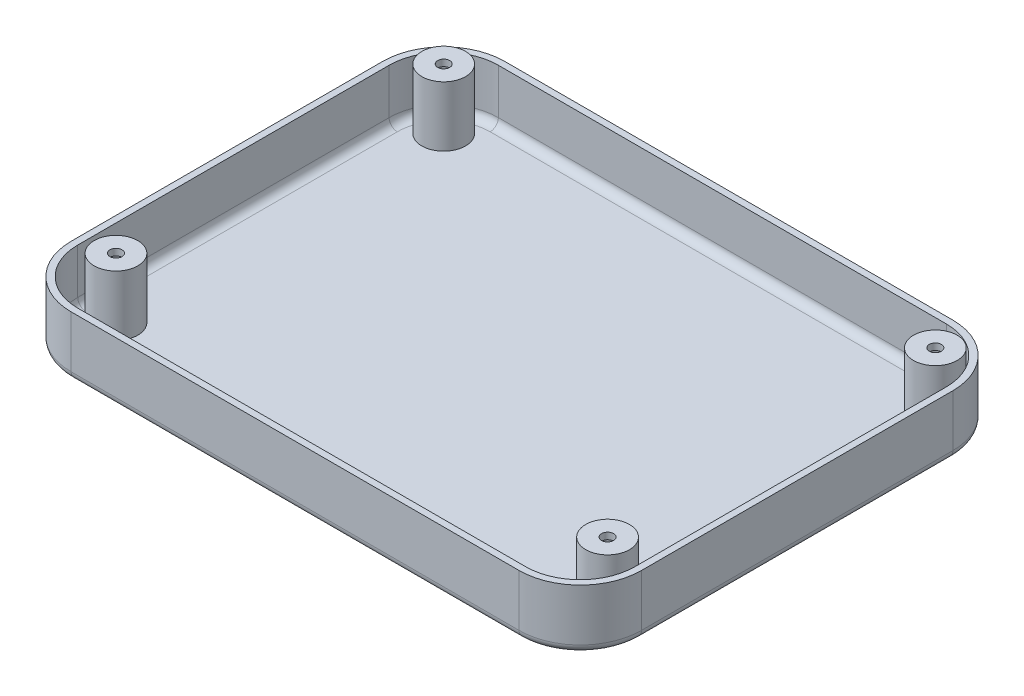
from build123d import *

# Parameters (mm, degrees)
EXTRUDE_3_DEPTH     = 1.2
EXTRUDE_4_DEPTH     = 11
SKETCH_6_R          = 4
SKETCH_6_R_2        = 2.4
EXTRUDE_5_DEPTH     = 11
CUT_EXTRUDE_START   = -10
SKETCH_7_R          = 2.4
SKETCH_7_R_2        = 1.7
CUT_EXTRUDE_1_DEPTH = 10
EXTRUDE_START       = -1.2
SKETCH_8_R          = 2.4
SKETCH_8_R_2        = 1.1
EXTRUDE_6_DEPTH     = 1.2
FILLET_1_R          = 1.5


with BuildPart() as part:
    # 草图1 → 凸台-拉伸3 (new body)
    with BuildSketch(Plane(origin=(0, 0, 0), x_dir=(1, 0, 0), z_dir=(0, 1, 0))):
        with BuildLine():
            Line((51, -26), (51, 26))
            ThreePointArc((51, 26), (48.071067812, 33.071067812), (41, 36))
            Line((41, 36), (-41, 36))
            ThreePointArc((-41, 36), (-48.071067812, 33.071067812), (-51, 26))
            Line((-51, 26), (-51, -26))
            Line((-51, -26), (-51, -31))
            ThreePointArc((-51, -31), (-48.071067812, -38.071067812), (-41, -41))
            Line((-41, -41), (41, -41))
            ThreePointArc((41, -41), (48.071067812, -38.071067812), (51, -31))
            Line((51, -31), (51, -26))
        make_face()
    extrude(amount=EXTRUDE_3_DEPTH)

    # 草图4 → 凸台-拉伸4 (add)
    with BuildSketch(Plane(origin=(0, 0, 0), x_dir=(1, 0, 0), z_dir=(0, 1, 0))):
        with BuildLine():
            Line((-41, 37.2), (41, 37.2))
            ThreePointArc((41, 37.2), (48.919595949, 33.919595949), (52.2, 26))
            Line((52.2, 26), (52.2, -26))
            Line((52.2, -26), (52.2, -31))
            ThreePointArc((52.2, -31), (48.919633331, -38.919505702), (41.000127629, -42.199872371))
            Line((41.000127629, -42.199872371), (-41.000127629, -42.199872371))
            ThreePointArc((-41.000127629, -42.199872371), (-48.919633331, -38.919505702), (-52.2, -31))
            Line((-52.2, -31), (-52.2, -26))
            Line((-52.2, -26), (-52.2, 26))
            ThreePointArc((-52.2, 26), (-48.919595949, 33.919595949), (-41, 37.2))
        make_face()
        with BuildLine():
            Line((51, -26), (51, 26))
            ThreePointArc((51, 26), (48.071067812, 33.071067812), (41, 36))
            Line((41, 36), (-41, 36))
            ThreePointArc((-41, 36), (-48.071067812, 33.071067812), (-51, 26))
            Line((-51, 26), (-51, -26))
            Line((-51, -26), (-51, -31))
            ThreePointArc((-51, -31), (-48.071105194, -38.070977564), (-41.000127629, -40.999872371))
            Line((-41.000127629, -40.999872371), (41.000127629, -40.999872371))
            ThreePointArc((41.000127629, -40.999872371), (48.071105194, -38.070977564), (51, -31))
            Line((51, -31), (51, -26))
        make_face(mode=Mode.SUBTRACT)
    extrude(amount=EXTRUDE_4_DEPTH)

    # 草图6 → 凸台-拉伸5 (add)
    # profile 1 of 4: a face of its own
    with BuildSketch(Plane(origin=(0, 1.2, 0), x_dir=(1, 0, 0), z_dir=(0, 1, 0))):
        with Locations(Location((-45, 30, 0), (0, 0, 90))):
            Circle(SKETCH_6_R)
        with Locations(Location((-45, 30, 0), (0, 0, 270))):
            Circle(SKETCH_6_R_2, mode=Mode.SUBTRACT)
    # profile 2 of 4: a face of its own
    with BuildSketch(Plane(origin=(0, 1.2, 0), x_dir=(1, 0, 0), z_dir=(0, 1, 0))):
        with Locations(Location((45, 30, 0), (0, 0, 90))):
            Circle(SKETCH_6_R)
        with Locations(Location((45, 30, 0), (0, 0, 90))):
            Circle(SKETCH_6_R_2, mode=Mode.SUBTRACT)
    # profile 3 of 4: a face of its own
    with BuildSketch(Plane(origin=(0, 1.2, 0), x_dir=(1, 0, 0), z_dir=(0, 1, 0))):
        with Locations(Location((45, -30, 0), (0, 0, 90))):
            Circle(SKETCH_6_R)
        with Locations(Location((45, -30, 0), (0, 0, 270))):
            Circle(SKETCH_6_R_2, mode=Mode.SUBTRACT)
    # profile 4 of 4: a face of its own
    with BuildSketch(Plane(origin=(0, 1.2, 0), x_dir=(1, 0, 0), z_dir=(0, 1, 0))):
        with Locations(Location((-45, -30, 0), (0, 0, 90))):
            Circle(SKETCH_6_R)
        with Locations(Location((-45, -30, 0), (0, 0, 90))):
            Circle(SKETCH_6_R_2, mode=Mode.SUBTRACT)
    extrude(amount=EXTRUDE_5_DEPTH)

    # 草图7 → 切除-拉伸1 (cut)
    with BuildSketch(Plane(origin=(0, 1.2, 0), x_dir=(1, 0, 0), z_dir=(0, 1, 0)).offset(CUT_EXTRUDE_START)):
        with Locations(Location((-45, 30, 0), (0, 0, 90))):
            Circle(SKETCH_7_R)
        with Locations(Location((45, 30, 0), (0, 0, 270))):
            Circle(SKETCH_7_R_2)
        with Locations(Location((45, -30, 0), (0, 0, 270))):
            Circle(SKETCH_7_R_2)
        with Locations(Location((-45, -30, 0), (0, 0, 90))):
            Circle(SKETCH_7_R)
    extrude(amount=CUT_EXTRUDE_1_DEPTH, mode=Mode.SUBTRACT)

    # 草图8 → 凸台-拉伸6 (add)
    # profile 1 of 4: a face of its own
    with BuildSketch(Plane(origin=(0, 12.2, 0), x_dir=(1, 0, 0), z_dir=(0, 1, 0)).offset(EXTRUDE_START)):
        with Locations(Location((-45, 30, 0), (0, 0, 90))):
            Circle(SKETCH_8_R)
        with Locations(Location((-45, 30, 0), (0, 0, 270))):
            Circle(SKETCH_8_R_2, mode=Mode.SUBTRACT)
    # profile 2 of 4: a face of its own
    with BuildSketch(Plane(origin=(0, 12.2, 0), x_dir=(1, 0, 0), z_dir=(0, 1, 0)).offset(EXTRUDE_START)):
        with Locations(Location((45, 30, 0), (0, 0, 90))):
            Circle(SKETCH_8_R)
        with Locations(Location((45, 30, 0), (0, 0, 90))):
            Circle(SKETCH_8_R_2, mode=Mode.SUBTRACT)
    # profile 3 of 4: a face of its own
    with BuildSketch(Plane(origin=(0, 12.2, 0), x_dir=(1, 0, 0), z_dir=(0, 1, 0)).offset(EXTRUDE_START)):
        with Locations(Location((45, -30, 0), (0, 0, 270))):
            Circle(SKETCH_8_R)
        with Locations(Location((45, -30, 0), (0, 0, 270))):
            Circle(SKETCH_8_R_2, mode=Mode.SUBTRACT)
    # profile 4 of 4: a face of its own
    with BuildSketch(Plane(origin=(0, 12.2, 0), x_dir=(1, 0, 0), z_dir=(0, 1, 0)).offset(EXTRUDE_START)):
        with Locations(Location((-45, -30, 0), (0, 0, 90))):
            Circle(SKETCH_8_R)
        with Locations(Location((-45, -30, 0), (0, 0, 90))):
            Circle(SKETCH_8_R_2, mode=Mode.SUBTRACT)
    extrude(amount=EXTRUDE_6_DEPTH)

    # 圆角1
    # the kernel refuses this fillet: 1.5 mm, written as the material it adds along each edge
    with BuildSketch(Plane(origin=(-41, 1.2, -26), x_dir=(0, 0, -1), z_dir=(1, 0, 0))) as fillet_1_piece_1:
        with BuildLine():
            CenterArc((10 - FILLET_1_R, FILLET_1_R), FILLET_1_R, 270, 90)
            Line((10, FILLET_1_R), (10, 0))
            Line((10, 0), (10 - FILLET_1_R, 0))
        make_face()
    revolve(axis=Axis((-41, 1.2, -26), (0, 1, 0)), revolution_arc=90)
    with BuildSketch(Plane(origin=(-51, 1.2, 31), x_dir=(1, 0, 0), z_dir=(0, 0, -1)), Plane(origin=(51, 1.2, -26), x_dir=(-1, 0, 0), z_dir=(0, 0, 1))) as fillet_1_piece_2:
        with BuildLine():
            CenterArc((FILLET_1_R, -FILLET_1_R), FILLET_1_R, 90, 90)
            Line((0, -FILLET_1_R), (0, 0))
            Line((0, 0), (FILLET_1_R, 0))
        make_face()
    extrude(amount=57)
    with BuildSketch(Plane(origin=(41, 1.2, -26), x_dir=(1, 0, 0), z_dir=(0, 0, 1))) as fillet_1_piece_3:
        with BuildLine():
            CenterArc((10 - FILLET_1_R, FILLET_1_R), FILLET_1_R, 270, 90)
            Line((10, FILLET_1_R), (10, 0))
            Line((10, 0), (10 - FILLET_1_R, 0))
        make_face()
    revolve(axis=Axis((41, 1.2, -26), (0, 1, 0)), revolution_arc=90)
    with BuildSketch(Plane(origin=(-41.000127629, 1.2, 31), x_dir=(0, 0, 1), z_dir=(1, 0, 0))) as fillet_1_piece_4:
        with BuildLine():
            CenterArc((9.999872371 - FILLET_1_R, -FILLET_1_R), FILLET_1_R, 0, 90)
            Line((9.999872371, -FILLET_1_R), (9.999872371, 0))
            Line((9.999872371, 0), (9.999872371 - FILLET_1_R, 0))
        make_face()
    revolve(axis=Axis((-41.000127629, 1.2, 31), (0, -1, 0)), revolution_arc=90)
    with BuildSketch(Plane(origin=(41.000127629, 1.2, 40.999872371), x_dir=(0, 0, -1), z_dir=(-1, 0, 0))) as fillet_1_piece_5:
        with BuildLine():
            CenterArc((FILLET_1_R, -FILLET_1_R), FILLET_1_R, 90, 90)
            Line((0, -FILLET_1_R), (0, 0))
            Line((0, 0), (FILLET_1_R, 0))
        make_face()
    extrude(amount=82.000255259)
    with BuildSketch(Plane(origin=(41.000127629, 1.2, 31), x_dir=(1, 0, 0), z_dir=(0, 0, -1))) as fillet_1_piece_6:
        with BuildLine():
            CenterArc((9.999872371 - FILLET_1_R, -FILLET_1_R), FILLET_1_R, 0, 90)
            Line((9.999872371, -FILLET_1_R), (9.999872371, 0))
            Line((9.999872371, 0), (9.999872371 - FILLET_1_R, 0))
        make_face()
    revolve(axis=Axis((41.000127629, 1.2, 31), (0, -1, 0)), revolution_arc=90)
    with BuildSketch(Plane(origin=(41, 1.2, -36), x_dir=(0, 0, 1), z_dir=(-1, 0, 0))) as fillet_1_piece_7:
        with BuildLine():
            CenterArc((FILLET_1_R, FILLET_1_R), FILLET_1_R, 180, 90)
            Line((0, FILLET_1_R), (0, 0))
            Line((0, 0), (FILLET_1_R, 0))
        make_face()
    extrude(amount=82)
    # the kernel refuses this fillet: 1.5 mm, written as the material it takes off along each edge
    with BuildSketch(Plane(origin=(-41, 0, -26), x_dir=(-1, 0, 0), z_dir=(0, 0, 1))) as fillet_1_2_piece_1:
        with BuildLine():
            CenterArc((11.2 - FILLET_1_R, -FILLET_1_R), FILLET_1_R, 0, 90)
            Line((11.2, -FILLET_1_R), (11.2, 0))
            Line((11.2, 0), (11.2 - FILLET_1_R, 0))
        make_face()
    revolve(axis=Axis((-41, 0, -26), (0, -1, 0)), revolution_arc=90, mode=Mode.SUBTRACT)
    with BuildSketch(Plane(origin=(-52.2, 0, -26), x_dir=(1, 0, 0), z_dir=(0, 0, 1)), Plane(origin=(52.2, 0, 31), x_dir=(-1, 0, 0), z_dir=(0, 0, -1))) as fillet_1_2_piece_2:
        with BuildLine():
            CenterArc((FILLET_1_R, FILLET_1_R), FILLET_1_R, 180, 90)
            Line((0, FILLET_1_R), (0, 0))
            Line((0, 0), (FILLET_1_R, 0))
        make_face()
    extrude(amount=57, mode=Mode.SUBTRACT)
    with BuildSketch(Plane(origin=(-41.000127629, 0, 31), x_dir=(0, 0, 1), z_dir=(1, 0, 0))) as fillet_1_2_piece_3:
        with BuildLine():
            CenterArc((11.199872371 - FILLET_1_R, -FILLET_1_R), FILLET_1_R, 0, 90)
            Line((11.199872371, -FILLET_1_R), (11.199872371, 0))
            Line((11.199872371, 0), (11.199872371 - FILLET_1_R, 0))
        make_face()
    revolve(axis=Axis((-41.000127629, 0, 31), (0, -1, 0)), revolution_arc=90, mode=Mode.SUBTRACT)
    with BuildSketch(Plane(origin=(41.000127629, 0, 42.199872371), x_dir=(0, 0, -1), z_dir=(-1, 0, 0))) as fillet_1_2_piece_4:
        with BuildLine():
            CenterArc((FILLET_1_R, -FILLET_1_R), FILLET_1_R, 90, 90)
            Line((0, -FILLET_1_R), (0, 0))
            Line((0, 0), (FILLET_1_R, 0))
        make_face()
    extrude(amount=82.000255259, mode=Mode.SUBTRACT)
    with BuildSketch(Plane(origin=(41.000127629, 0, 31), x_dir=(1, 0, 0), z_dir=(0, 0, -1))) as fillet_1_2_piece_5:
        with BuildLine():
            CenterArc((11.199872371 - FILLET_1_R, -FILLET_1_R), FILLET_1_R, 0, 90)
            Line((11.199872371, -FILLET_1_R), (11.199872371, 0))
            Line((11.199872371, 0), (11.199872371 - FILLET_1_R, 0))
        make_face()
    revolve(axis=Axis((41.000127629, 0, 31), (0, -1, 0)), revolution_arc=90, mode=Mode.SUBTRACT)
    with BuildSketch(Plane(origin=(41, 0, -26), x_dir=(0, 0, -1), z_dir=(-1, 0, 0))) as fillet_1_2_piece_6:
        with BuildLine():
            CenterArc((11.2 - FILLET_1_R, -FILLET_1_R), FILLET_1_R, 0, 90)
            Line((11.2, -FILLET_1_R), (11.2, 0))
            Line((11.2, 0), (11.2 - FILLET_1_R, 0))
        make_face()
    revolve(axis=Axis((41, 0, -26), (0, -1, 0)), revolution_arc=90, mode=Mode.SUBTRACT)
    with BuildSketch(Plane(origin=(-41, 0, -37.2), x_dir=(0, 0, 1), z_dir=(1, 0, 0))) as fillet_1_2_piece_7:
        with BuildLine():
            CenterArc((FILLET_1_R, -FILLET_1_R), FILLET_1_R, 90, 90)
            Line((0, -FILLET_1_R), (0, 0))
            Line((0, 0), (FILLET_1_R, 0))
        make_face()
    extrude(amount=82, mode=Mode.SUBTRACT)


solid = part.part
